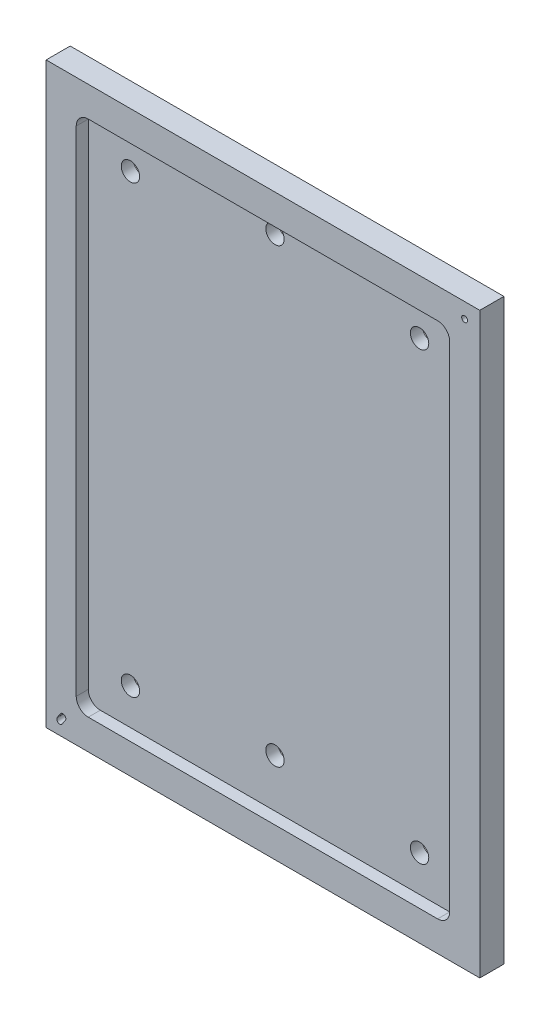
from build123d import *

# Parameters (mm, degrees)
SKETCH1_W                      = 228.6
SKETCH1_H                      = 304.8
BOSS_EXTRUDE1_DEPTH            = 12.7
CUT_EXTRUDE1_DEPTH             = 6.35
SKETCH4_R                      = 4.85
CUT_EXTRUDE2_DEPTH             = 191.605803952
F_3_1_3_1_DIAMETER_HOLE1_D     = 3.1
F_3_1_3_1_DIAMETER_HOLE1_DEPTH = 5
F_3_1_3_1_DIAMETER_HOLE1_TIP   = 0.931333959
CUT_EXTRUDE3_DEPTH             = 5
M4X0_7_TAPPED_HOLE1_D          = 3.3
M4X0_7_TAPPED_HOLE1_DEPTH      = 5.4
M4X0_7_TAPPED_HOLE1_TIP        = 0.991420021


with BuildPart() as part:
    # Sketch1 → Boss-Extrude1 (new body)
    with BuildSketch(Plane.XY):
        Rectangle(SKETCH1_W, SKETCH1_H)
    extrude(amount=BOSS_EXTRUDE1_DEPTH)

    # Sketch2 → Cut-Extrude1 (cut)
    with BuildSketch(Plane.XY.offset(12.7)):
        with BuildLine():
            Line((92.075, -136.525), (-92.075, -136.525))
            ThreePointArc((-92.075, -136.525), (-96.565128061, -134.665128061), (-98.425, -130.175))
            Line((-98.425, -130.175), (-98.425, 130.175))
            ThreePointArc((-98.425, 130.175), (-96.565128061, 134.665128061), (-92.075, 136.525))
            Line((-92.075, 136.525), (92.075, 136.525))
            ThreePointArc((92.075, 136.525), (96.565128061, 134.665128061), (98.425, 130.175))
            Line((98.425, 130.175), (98.425, -130.175))
            ThreePointArc((98.425, -130.175), (96.565128061, -134.665128061), (92.075, -136.525))
        make_face()
    extrude(amount=-CUT_EXTRUDE1_DEPTH, mode=Mode.SUBTRACT)

    # Sketch4 → Cut-Extrude2 (cut, through all)
    with BuildSketch(Plane.XY.offset(6.35)):
        with Locations((-76.2, 117.4)):
            Circle(SKETCH4_R)
        with Locations((76.2, 117.4)):
            Circle(SKETCH4_R)
        with Locations((-76.2, -117.4)):
            Circle(SKETCH4_R)
        with Locations((76.2, -117.4)):
            Circle(SKETCH4_R)
        with Locations((0, 126.925)):
            Circle(SKETCH4_R)
        with Locations((0, -111.125)):
            Circle(SKETCH4_R)
    extrude(amount=-CUT_EXTRUDE2_DEPTH, mode=Mode.SUBTRACT)

    # Ø3.1 (3.1) Diameter Hole1
    with Locations(Plane.XY.offset(12.7)):
        with Locations((106.3, 144.4)):
            Hole(F_3_1_3_1_DIAMETER_HOLE1_D / 2, depth=F_3_1_3_1_DIAMETER_HOLE1_DEPTH)
            with Locations((0, 0, -(F_3_1_3_1_DIAMETER_HOLE1_DEPTH + F_3_1_3_1_DIAMETER_HOLE1_TIP / 2))):  # 118° drill point
                Cone(0, F_3_1_3_1_DIAMETER_HOLE1_D / 2, F_3_1_3_1_DIAMETER_HOLE1_TIP, mode=Mode.SUBTRACT)

    # Sketch7 → Cut-Extrude3 (cut)
    with BuildSketch(Plane.XY.offset(12.7)):
        with BuildLine():
            Line((-108.420428502, -144.795326406), (-106.764617546, -142.29366894))
            ThreePointArc((-106.764617546, -142.29366894), (-104.616592195, -141.856648243), (-104.179571498, -144.004673594))
            Line((-104.179571498, -144.004673594), (-105.835382454, -146.50633106))
            ThreePointArc((-105.835382454, -146.50633106), (-107.983407805, -146.943351757), (-108.420428502, -144.795326406))
        make_face()
    extrude(amount=-CUT_EXTRUDE3_DEPTH, mode=Mode.SUBTRACT)

    # M4x0.7 Tapped Hole1
    with Locations(Plane(origin=(0, 0, 0), x_dir=(-1, 0, 0), z_dir=(0, 0, -1))):
        with Locations((-106.3, -102.4), (-106.3, 0), (-106.3, 113.6)):
            Hole(M4X0_7_TAPPED_HOLE1_D / 2, depth=M4X0_7_TAPPED_HOLE1_DEPTH)
            with Locations((0, 0, -(M4X0_7_TAPPED_HOLE1_DEPTH + M4X0_7_TAPPED_HOLE1_TIP / 2))):  # 118° drill point
                Cone(0, M4X0_7_TAPPED_HOLE1_D / 2, M4X0_7_TAPPED_HOLE1_TIP, mode=Mode.SUBTRACT)


solid = part.part
